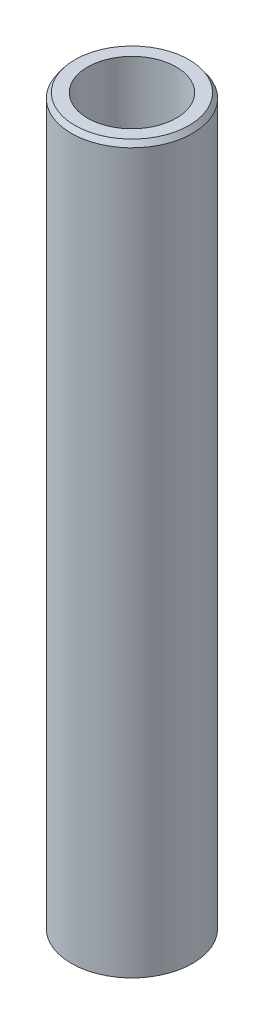
from build123d import *
from OCP.BRepFilletAPI import BRepFilletAPI_MakeChamfer

# Parameters (mm, degrees)
SKETCH1_R           = 50
BOSS_EXTRUDE1_DEPTH = 600
SKETCH2_R           = 36.590321845
CUT_EXTRUDE1_DEPTH  = 605.15229868
CHAMFER1_SIZE       = 4.130765329
CHAMFER1_SIZE2      = 2.964266646


with BuildPart() as part:
    # Sketch1 → Boss-Extrude1 (new body)
    with BuildSketch(Plane(origin=(0, 0, 0), x_dir=(1, 0, 0), z_dir=(0, 1, 0))):
        Circle(SKETCH1_R)
    extrude(amount=BOSS_EXTRUDE1_DEPTH)

    # Sketch2 → Cut-Extrude1 (cut, through all)
    with BuildSketch(Plane(origin=(0, 0, 0), x_dir=(1, 0, 0), z_dir=(0, 1, 0))):
        Circle(SKETCH2_R)
    extrude(amount=CUT_EXTRUDE1_DEPTH, mode=Mode.SUBTRACT)

    # Chamfer1: one chamfer whose edges measure the first distance from different faces: ONE call of the kernel's chamfer builder (chamfer() names one face for all edges)
    chamfer1_edges_1 = [part.edges().sort_by_distance(p)[0] for p in [
        (-50, 600, 0),
    ]]
    chamfer1_side_1 = [part.faces().sort_by_distance(p)[0] for p in [
        (-50, 300, 0),
    ]]
    chamfer1_edges_2 = [part.edges().sort_by_distance(p)[0] for p in [
        (-50, 0, 0),
    ]]
    chamfer1_side_2 = [part.faces().sort_by_distance(p)[0] for p in [
        (-48.585786438, 0, 0),
    ]]
    chamfer1 = BRepFilletAPI_MakeChamfer(part.part.solid().wrapped)
    for e in chamfer1_edges_1:
        chamfer1.Add(CHAMFER1_SIZE, CHAMFER1_SIZE2, e.wrapped, chamfer1_side_1[0].wrapped)  # the first distance lies on this face
    for e in chamfer1_edges_2:
        chamfer1.Add(CHAMFER1_SIZE, CHAMFER1_SIZE2, e.wrapped, chamfer1_side_2[0].wrapped)  # the first distance lies on this face
    add(Compound.cast(chamfer1.Shape()), mode=Mode.REPLACE)


solid = part.part
